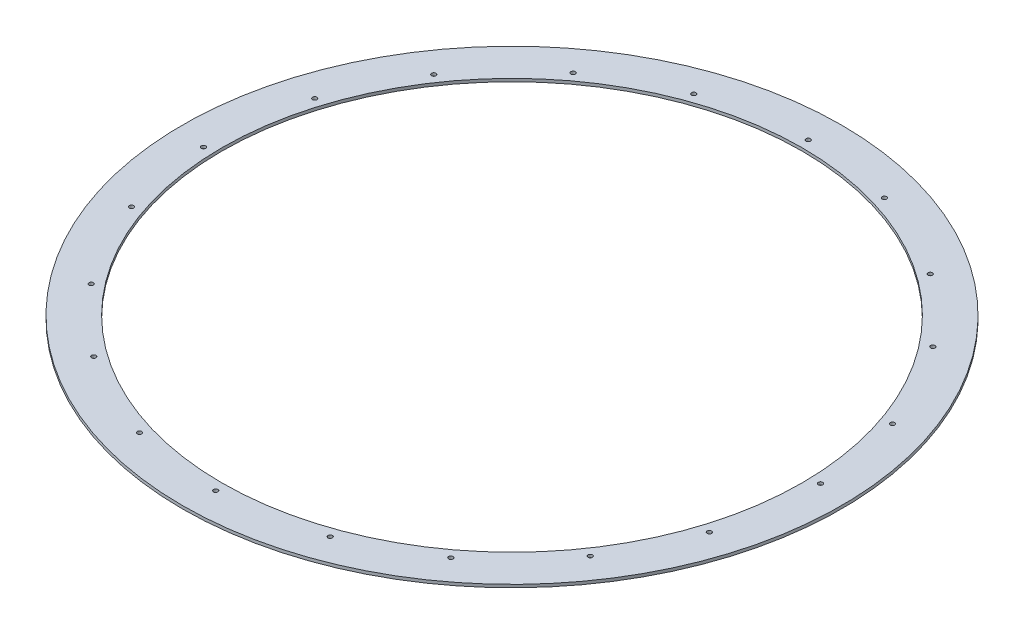
from build123d import *

# Parameters (mm, degrees)
SKETCH1_R                      = 335
SKETCH1_R_2                    = 295
BOSS_EXTRUDE1_DEPTH            = 3
CBORE_FOR_M4_SHCS1_D           = 4.5
CBORE_FOR_M4_SHCS1_DEPTH       = 31
CBORE_FOR_M4_SHCS1_CBORE_D     = 8
CBORE_FOR_M4_SHCS1_CBORE_DEPTH = 4
CBORE_FOR_M4_SHCS1_TIP         = 1.351936393


with BuildPart() as part:
    # Sketch1 → Boss-Extrude1 (new body)
    with BuildSketch(Plane(origin=(0, 0, 0), x_dir=(1, 0, 0), z_dir=(0, 1, 0))):
        Circle(SKETCH1_R)
        Circle(SKETCH1_R_2, mode=Mode.SUBTRACT)
    extrude(amount=BOSS_EXTRUDE1_DEPTH)

    # CBORE for M4 SHCS1
    with Locations(Plane(origin=(-17.805881144, 23, -255.054301437), x_dir=(0.3445819258020783, 0, -0.9387562497318093), z_dir=(0, 1, 0))):
        with Locations((24.768519996, -267.164934521), (61.127362999, -184.2176052), (-120.069655116, -387.806101735), (-41.899516339, -342.071494384), (-308.157299123, -400.273112932), (-218.03420068, -409.220293097), (-467.651324879, -299.803993574), (-399.999227203, -360.015442535), (-537.630435548, -124.774532435), (-518.290140541, -213.251523201), (-491.364989355, 57.959965362), (-527.723832358, -24.987363958), (-346.526814243, 178.601132576), (-424.69695302, 132.866525225), (-158.439170236, 191.068143774), (-248.562268679, 200.015323938), (1.054855521, 90.599024415), (-66.597242155, 150.810473376), (71.033966189, -84.430436724), (51.693671182, 4.046554042), (-233.298234679, -104.602484579)):
            CounterBoreHole(CBORE_FOR_M4_SHCS1_D / 2, CBORE_FOR_M4_SHCS1_CBORE_D / 2, CBORE_FOR_M4_SHCS1_CBORE_DEPTH, depth=CBORE_FOR_M4_SHCS1_DEPTH)
            with Locations((0, 0, -(CBORE_FOR_M4_SHCS1_DEPTH + CBORE_FOR_M4_SHCS1_TIP / 2))):  # 118° drill point
                Cone(0, CBORE_FOR_M4_SHCS1_D / 2, CBORE_FOR_M4_SHCS1_TIP, mode=Mode.SUBTRACT)


solid = part.part
